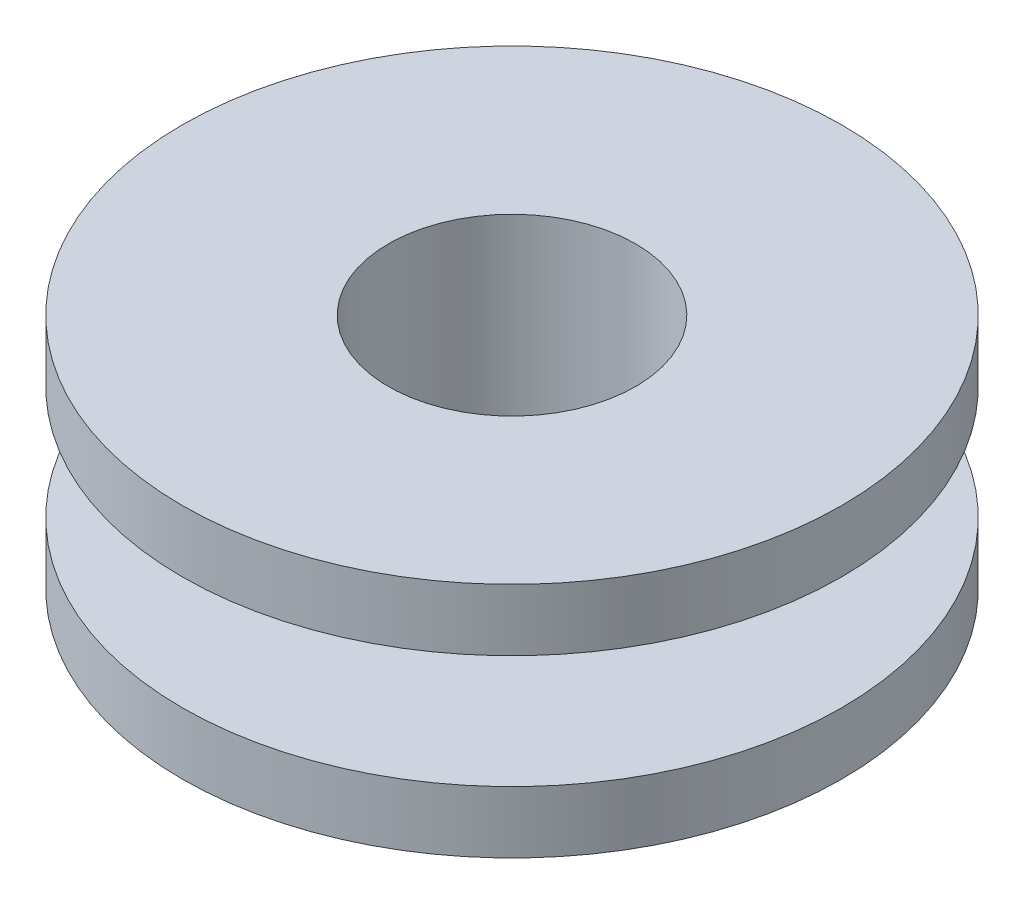
from build123d import *


with BuildPart() as part:
    # Sketch1 → Revolve1 (revolve)
    with BuildSketch(Plane.XY):
        Polygon((6, 0), (6, 11.5), (16, 11.5), (16, 8.5), (8, 8.5), (8, 3), (16, 3), (16, 0), align=None)
    revolve(axis=Axis((0, 0, 0), (0, 1, 0)))


solid = part.part
